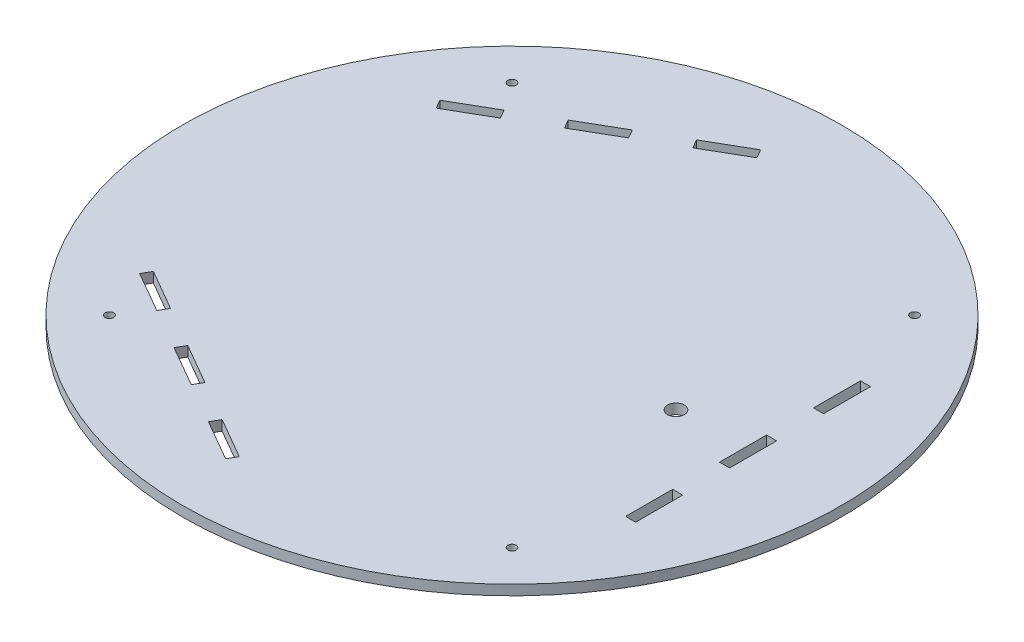
from build123d import *

# Parameters (mm, degrees)
ESQUISSE1_R             = 196.45866198
BOSS_EXTRU_1_DEPTH      = 6
EMPREINTE1_START        = -84
EMPREINTE1_OUTLINE_W    = 6
EMPREINTE1_OUTLINE_H    = 28
EMPREINTE1_DEPTH        = 6
ESQUISSE2_R             = 5
ENL_V_MAT_EXTRU_1_DEPTH = 10


# Read off the part's stored shape, not the designer's step: Empreinte1
with BuildPart() as part:
    # Esquisse1 → Boss.-Extru.1 (new body)
    with BuildSketch(Plane(origin=(0, -78, 0), x_dir=(-1, 0, 0), z_dir=(0, -1, 0))):
        with Locations(Location((0, 0, 0), (0, 0, 90))):
            Circle(ESQUISSE1_R)
    extrude(amount=BOSS_EXTRU_1_DEPTH)

    # Empreinte1 outline → Empreinte1 (cut)
    with BuildSketch(Plane(origin=(0, 0, 0), x_dir=(1, 0, 0), z_dir=(0, 1, 0)).offset(EMPREINTE1_START)):
        Polygon((-11.249911594, 159.485418462), (-35.4986229, 145.485418462), (-32.4986229, 140.28926604), (-8.249911594, 154.28926604), align=None)
        Polygon((-59.747334206, 131.485418462), (-83.996045512, 117.485418462), (-80.996045512, 112.28926604), (-56.747334206, 126.28926604), align=None)
        Polygon((-108.244756818, 103.485418462), (-132.493468124, 89.485418462), (-129.493468124, 84.28926604), (-105.244756818, 98.28926604), align=None)
        with Locations((140.743379719, -56)):
            Rectangle(EMPREINTE1_OUTLINE_W, EMPREINTE1_OUTLINE_H)
        with Locations((140.743379719, 0)):
            Rectangle(EMPREINTE1_OUTLINE_W, EMPREINTE1_OUTLINE_H)
        with Locations((140.743379719, 56)):
            Rectangle(EMPREINTE1_OUTLINE_W, EMPREINTE1_OUTLINE_H)
        Polygon((-132.493468124, -89.485418462), (-108.244756818, -103.485418462), (-105.244756818, -98.28926604), (-129.493468124, -84.28926604), align=None)
        Polygon((-83.996045512, -117.485418462), (-59.747334206, -131.485418462), (-56.747334206, -126.28926604), (-80.996045512, -112.28926604), align=None)
        Polygon((-35.4986229, -145.485418462), (-11.249911594, -159.485418462), (-8.249911594, -154.28926604), (-32.4986229, -140.28926604), align=None)
    extrude(amount=EMPREINTE1_DEPTH, mode=Mode.SUBTRACT)

    # Esquisse2 → Enlèv. mat.-Extru.1 (cut)
    with BuildSketch(Plane(origin=(0, -78, 0), x_dir=(1, 0, 0), z_dir=(0, 1, 0))):
        with BuildLine():
            ThreePointArc((-117.5, 120), (-121.767766953, 121.767766953), (-120, 117.5))
            Line((-120, 117.5), (-120, 120))
            Line((-120, 120), (-117.5, 120))
        make_face()
        with BuildLine():
            Line((-120, 120), (-120, 117.5))
            ThreePointArc((-120, 117.5), (-118.232233047, 118.232233047), (-117.5, 120))
            Line((-117.5, 120), (-120, 120))
        make_face()
        with BuildLine():
            ThreePointArc((117.5, 120), (118.232233047, 118.232233047), (120, 117.5))
            Line((120, 117.5), (120, 120))
            Line((120, 120), (117.5, 120))
        make_face()
        with BuildLine():
            Line((120, 120), (120, 117.5))
            ThreePointArc((120, 117.5), (121.767766953, 118.232233047), (122.5, 120))
            ThreePointArc((122.5, 120), (120, 122.5), (117.5, 120))
            Line((117.5, 120), (120, 120))
        make_face()
        with BuildLine():
            ThreePointArc((120, -117.5), (118.232233047, -118.232233047), (117.5, -120))
            Line((117.5, -120), (120, -120))
            Line((120, -120), (120, -117.5))
        make_face()
        with BuildLine():
            Line((120, -120), (117.5, -120))
            ThreePointArc((117.5, -120), (120, -122.5), (122.5, -120))
            ThreePointArc((122.5, -120), (121.767766953, -118.232233047), (120, -117.5))
            Line((120, -117.5), (120, -120))
        make_face()
        with BuildLine():
            Line((-120, -117.5), (-120, -120))
            Line((-120, -120), (-117.5, -120))
            ThreePointArc((-117.5, -120), (-118.232233047, -118.232233047), (-120, -117.5))
        make_face()
        with BuildLine():
            Line((-117.5, -120), (-120, -120))
            Line((-120, -120), (-120, -117.5))
            ThreePointArc((-120, -117.5), (-121.767766953, -121.767766953), (-117.5, -120))
        make_face()
        with Locations(Location((97.743379719, 0, 0), (0, 0, 270))):
            Circle(ESQUISSE2_R)
    extrude(amount=-ENL_V_MAT_EXTRU_1_DEPTH, mode=Mode.SUBTRACT)


solid = part.part
